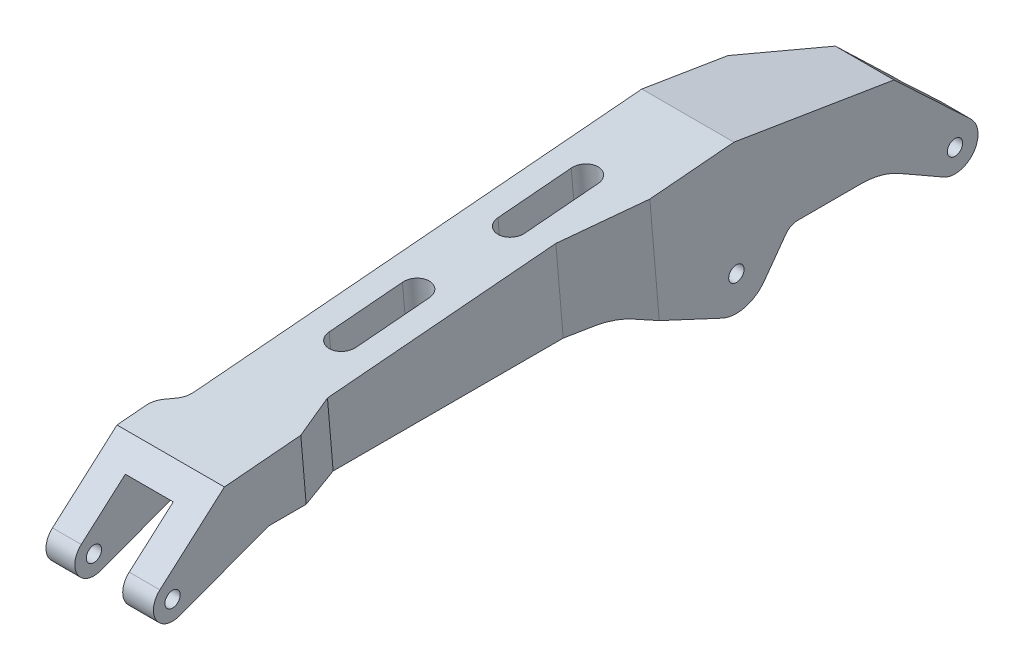
from build123d import *

# Parameters (mm, degrees)
SKETCH1_R           = 2
BOSS_EXTRUDE1_DEPTH = 12
CUT_EXTRUDE1_DEPTH  = 162.777588211
SKETCH5_R           = 2
BOSS_EXTRUDE3_DEPTH = 4
CUT_EXTRUDE2_DEPTH  = 12.5
CHAMFER1_SIZE       = 3
FILLET1_R           = 4
CUT_EXTRUDE3_DEPTH  = 156.224708777
CUT_EXTRUDE4_DEPTH  = 156.224708777


with BuildPart() as part:
    # Sketch1 → Boss-Extrude1 (new, symmetric)
    with BuildSketch(Plane(origin=(0, 0, 0), x_dir=(0, 0, -1), z_dir=(1, 0, 0))):
        with BuildLine():
            Line((-121.907859823, 4), (-145.256630116, -4.68622038))
            ThreePointArc((-145.256630116, -4.68622038), (-151.290045259, -2.568172828), (-150.306967189, 3.75019573))
            Line((-150.306967189, 3.75019573), (-133.491442782, 18.578325107))
            Line((-133.491442782, 18.578325107), (-0.653491001, 30.01252535))
            Line((-0.653491001, 30.01252535), (41.089036304, 23.188119662))
            Line((41.089036304, 23.188119662), (61.107888441, 4.370001963))
            ThreePointArc((61.107888441, 4.370001963), (61.822541623, -3.565775777), (54.025769542, -5.208225973))
            Line((54.025769542, -5.208225973), (42.456256278, 1.398706774))
            ThreePointArc((42.456256278, 1.398706774), (37.66895292, 3.361815488), (32.53825078, 4.031117219))
            Line((32.53825078, 4.031117219), (16.022685374, 4.031117219))
            ThreePointArc((16.022685374, 4.031117219), (14.241499513, 3.602468352), (12.850348738, 2.410385115))
            Line((12.850348738, 2.410385115), (7.292636005, -5.274226019))
            ThreePointArc((7.292636005, -5.274226019), (2.262889815, -8.71087422), (-3.803564356, -8.156770083))
            Line((-3.803564356, -8.156770083), (-25.855369948, 2.126155741))
            ThreePointArc((-25.855369948, 2.126155741), (-29.978942905, 3.525920142), (-34.307735183, 4))
            Line((-34.307735183, 4), (-121.907859823, 4))
        make_face()
        Circle(SKETCH1_R, mode=Mode.SUBTRACT)
        with Locations((57, 0)):
            Circle(SKETCH1_R, mode=Mode.SUBTRACT)
        with Locations((-147, 0)):
            Circle(SKETCH1_R, mode=Mode.SUBTRACT)
    extrude(amount=BOSS_EXTRUDE1_DEPTH, both=True)

    # Sketch2 → Cut-Extrude1 (cut, through all)
    with BuildSketch(Plane(origin=(0, 29.127166191, -4.761944507), x_dir=(1, 0, 0), z_dir=(0, 0.9868978946219392, -0.16134604299698216))):
        Polygon((3.5, 62.250818245), (3.5, 52.064388241), (-12, 17.250818245), (-12, 62.250818245), align=None)
    extrude(amount=-CUT_EXTRUDE1_DEPTH, mode=Mode.SUBTRACT)

    # Sketch5 → Boss-Extrude3 (add)
    with BuildSketch(Plane.ZY.offset(12)):
        with BuildLine():
            Line((145.256630116, -4.68622038), (121.907859823, 4))
            Line((121.907859823, 4), (108.907859823, 4))
            Line((108.907859823, 4), (120.491442782, 19.697317091))
            Line((120.491442782, 19.697317091), (133.491442782, 18.578325107))
            Line((133.491442782, 18.578325107), (150.306967189, 3.75019573))
            ThreePointArc((150.306967189, 3.75019573), (151.290045259, -2.568172828), (145.256630116, -4.68622038))
        make_face()
        with Locations((147, 0)):
            Circle(SKETCH5_R, mode=Mode.SUBTRACT)
    extrude(amount=BOSS_EXTRUDE3_DEPTH)

    # Sketch6 → Cut-Extrude2 (cut)
    with BuildSketch(Plane(origin=(4, 0, 0), x_dir=(0, 0, -1), z_dir=(1, 0, 0))):
        with BuildLine():
            Line((-150.306967189, 3.75019573), (-138.821377712, 13.878325107))
            Line((-138.821377712, 13.878325107), (50.992864285, 13.878325107))
            Line((50.992864285, 13.878325107), (61.107888441, 4.370001963))
            ThreePointArc((61.107888441, 4.370001963), (61.822541623, -3.565775777), (54.025769542, -5.208225973))
            Line((54.025769542, -5.208225973), (42.456256278, 1.398706774))
            ThreePointArc((42.456256278, 1.398706774), (37.66895292, 3.361815488), (32.53825078, 4.031117219))
            Line((32.53825078, 4.031117219), (16.022685374, 4.031117219))
            ThreePointArc((16.022685374, 4.031117219), (14.241499513, 3.602468352), (12.850348738, 2.410385115))
            Line((12.850348738, 2.410385115), (7.292636005, -5.274226019))
            ThreePointArc((7.292636005, -5.274226019), (2.262889815, -8.71087422), (-3.803564356, -8.156770083))
            Line((-3.803564356, -8.156770083), (-25.855369948, 2.126155741))
            ThreePointArc((-25.855369948, 2.126155741), (-29.978942905, 3.525920142), (-34.307735183, 4))
            Line((-34.307735183, 4), (-121.907859823, 4))
            Line((-121.907859823, 4), (-145.256630116, -4.68622038))
            ThreePointArc((-145.256630116, -4.68622038), (-151.290045259, -2.568172828), (-150.306967189, 3.75019573))
        make_face()
    extrude(amount=-CUT_EXTRUDE2_DEPTH, mode=Mode.SUBTRACT)

    # Chamfer1
    chamfer1_edges = [part.edges().sort_by_distance(p)[0] for p in [
        (-16, 11.848658545, 114.699651303),
    ]]
    chamfer(chamfer1_edges, length=CHAMFER1_SIZE)

    # Fillet1
    # the kernel refuses this fillet: 4 mm, written as the material it adds along each edge
    with BuildSketch(Plane(origin=(-12, -1.322167469, 104.980451844), x_dir=(-1, 0, 0), z_dir=(0, 0.8046360890172893, 0.593768274877465))) as fillet1_piece_1_section:
        with BuildLine():
            CenterArc((4, -2.645751311), FILLET1_R, 138.590377891, 41.409622109)
            Line((0, -2.645751311), (0, 0))
            Line((0, 0), (1, 0))
        make_face()
    fillet1_piece_1 = extrude(amount=32.737348458, mode=Mode.PRIVATE)
    fillet1_piece_1 = split(fillet1_piece_1, bisect_by=Plane(origin=(-12, 20.868035787, 106.890502579), z_dir=(0, -0.9963158941582452, -0.08575919220501364)), keep=Keep.TOP, mode=Mode.PRIVATE)
    fillet1_piece_1 = split(fillet1_piece_1, bisect_by=Plane(origin=(-12, 4, 104.980451844), z_dir=(0, 1, 0)), keep=Keep.TOP, mode=Mode.PRIVATE)
    add(fillet1_piece_1)
    # the kernel refuses this fillet: 4 mm, written as the material it takes off along each edge
    with BuildSketch(Plane(origin=(-16, 0.667088192, 110.176784644), x_dir=(0, -0.593768274877465, 0.8046360890172894), z_dir=(0, 0.8046360890172893, 0.593768274877465))) as fillet1_2_piece_1:
        with BuildLine():
            CenterArc((FILLET1_R * 0.414213562373, FILLET1_R), FILLET1_R, 225, 45)
            Line((-FILLET1_R * 0.292893218813, FILLET1_R * 0.292893218813), (0, 0))
            Line((0, 0), (FILLET1_R * 0.414213562373, 0))
        make_face()
    extrude(amount=27.417837682, mode=Mode.SUBTRACT)

    # Sketch7 → Cut-Extrude3 (cut, through all)
    with BuildSketch(Plane(origin=(0, 29.847630452, 2.569173785), x_dir=(1, 0, 0), z_dir=(0, 0.9963158941582453, 0.08575919220501363))):
        Polygon((12, -111.406384024), (8, -100.416474347), (8, -40.655449605), (12, -20.077233541), align=None)
    extrude(amount=-CUT_EXTRUDE3_DEPTH, mode=Mode.SUBTRACT)

    # Sketch8 → Cut-Extrude4 (cut, through all)
    with BuildSketch(Plane(origin=(0, 29.847630452, 2.569173785), x_dir=(1, 0, 0), z_dir=(0, 0.9963158941582453, 0.08575919220501363))):
        with BuildLine():
            Line((-5.5, -42.241808783), (-5.5, -23.077233541))
            ThreePointArc((-5.5, -23.077233541), (-2, -19.577233541), (1.5, -23.077233541))
            Line((1.5, -23.077233541), (1.5, -42.241808783))
            ThreePointArc((1.5, -42.241808783), (-2, -45.741808783), (-5.5, -42.241808783))
        make_face()
        with BuildLine():
            Line((-5.5, -86.406384024), (-5.5, -67.241808783))
            ThreePointArc((-5.5, -67.241808783), (-2, -63.741808783), (1.5, -67.241808783))
            Line((1.5, -67.241808783), (1.5, -86.406384024))
            ThreePointArc((1.5, -86.406384024), (-2, -89.906384024), (-5.5, -86.406384024))
        make_face()
    extrude(amount=-CUT_EXTRUDE4_DEPTH, mode=Mode.SUBTRACT)


solid = part.part
